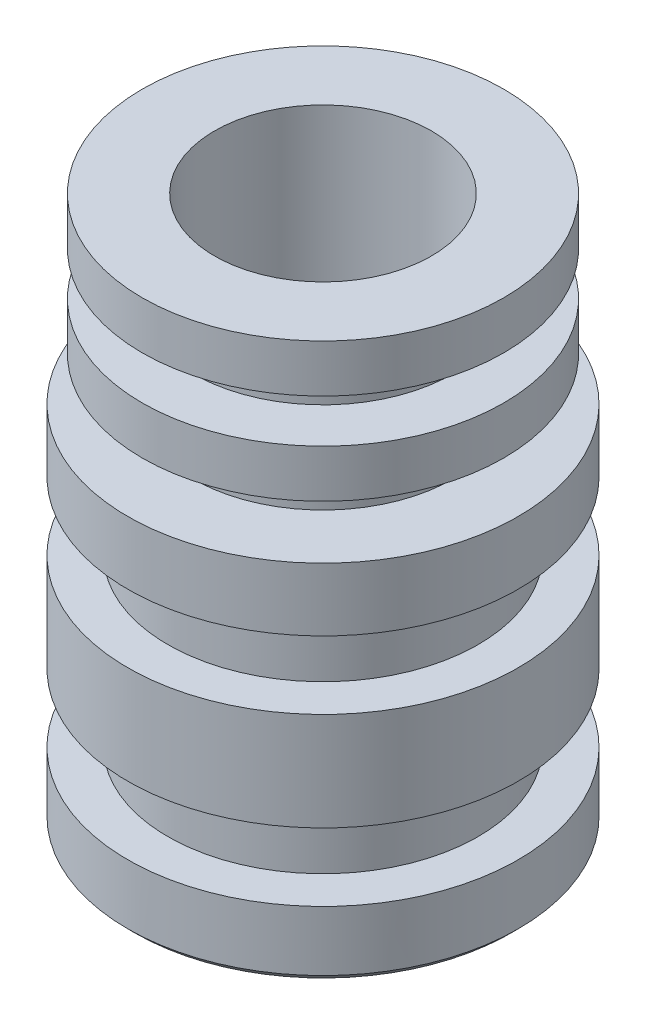
from build123d import *

# Parameters (mm, degrees)
ESQUISSE4_R             = 2
ENL_V_MAT_EXTRU_3_DEPTH = 43.347845282
CHANFREIN4_SIZE         = 0.5
CHANFREIN3_SIZE         = 0.5


with BuildPart() as part:
    # Esquisse1 → Révolution1 (revolve)
    with BuildSketch(Plane.XY):
        Polygon((0, 0), (-13.5, 0), (-13.5, 4.64), (-10.73, 4.64), (-10.73, 9.34), (-13.5, 9.34), (-13.5, 16.14), (-10.73, 16.14), (-10.73, 20.84), (-13.5, 20.84), (-13.5, 25.2), (-12.5, 25.2), (-9, 25.2), (-9, 28.2), (-12.5, 28.2), (-12.5, 31.5), (-9, 31.5), (-9, 34.5), (-12.5, 34.5), (-12.5, 37.8), (-7.5, 37.8), (-7.5, 20.84), (-7.5, 8), (0, 8), align=None)
    revolve(axis=Axis((0, -29.115408637, 0), (0, 1, 0)))

    # Esquisse4 → Enlèv. mat.-Extru.3 (cut, through all)
    with BuildSketch(Plane.XZ):
        Circle(ESQUISSE4_R)
    extrude(amount=-ENL_V_MAT_EXTRU_3_DEPTH, mode=Mode.SUBTRACT)

    # Chanfrein4
    chanfrein4_edges = [part.edges().sort_by_distance(p)[0] for p in [
        (-2, 8, 0),
        (-2, 0, 0),
    ]]
    chamfer(chanfrein4_edges, length=CHANFREIN4_SIZE)

    # Chanfrein3
    chanfrein3_edges = [part.edges().sort_by_distance(p)[0] for p in [
        (13.5, 0, 0),
    ]]
    chamfer(chanfrein3_edges, length=CHANFREIN3_SIZE)


solid = part.part
